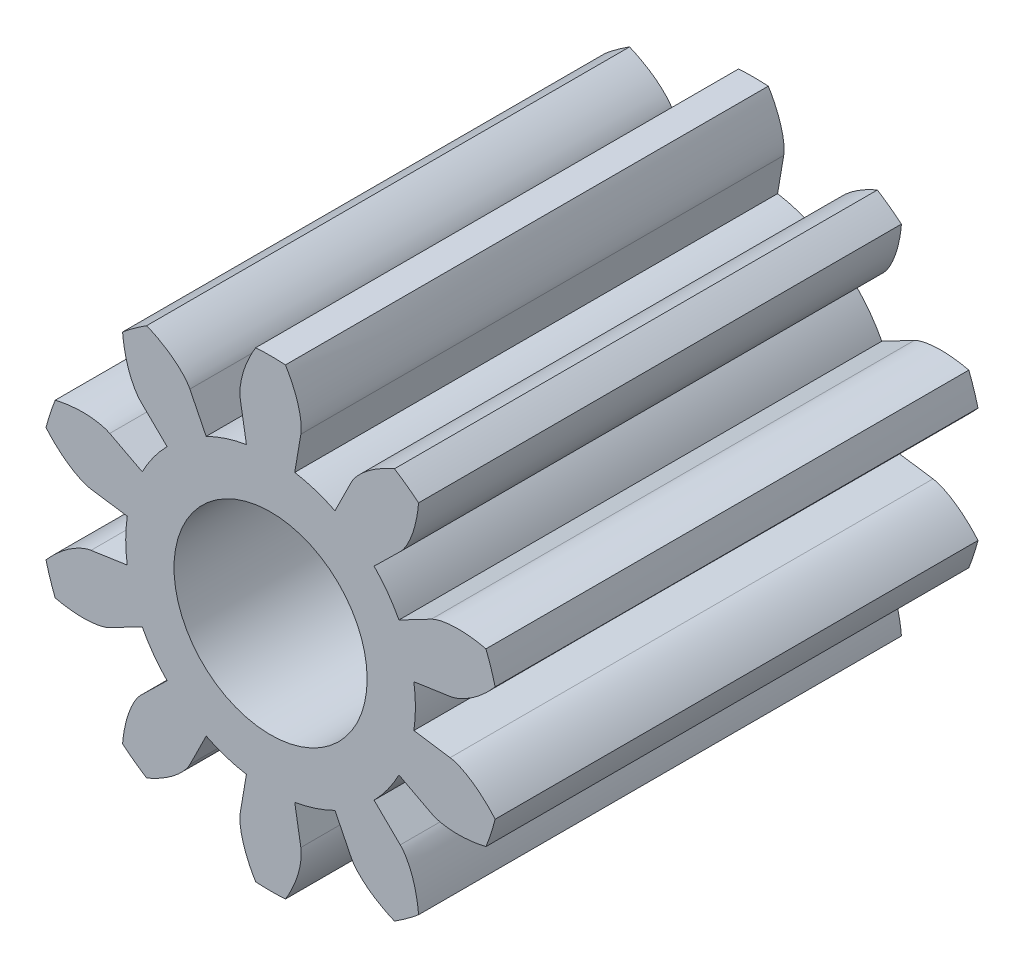
from build123d import *

# Parameters (mm, degrees)
SKETCH_1_R               = 1.2
SKETCH_1_R_2             = 0.5
EXTRUDE_1_DEPTH          = 2.5
CUT_EXTRUDE_1_DEPTH      = 4.021588986
PATTERN_CIRCULAR_1_COUNT = 10
PATTERN_CIRCULAR_1_ANGLE = 324


with BuildPart() as part:
    # 草图1 → 凸台-拉伸1 (new body)
    with BuildSketch(Plane.XY):
        Circle(SKETCH_1_R)
        Circle(SKETCH_1_R_2, mode=Mode.SUBTRACT)
    extrude(amount=EXTRUDE_1_DEPTH)

    # 草图1<3> → 切除-拉伸1 (cut, through all)
    with BuildSketch(Plane.XY):
        with BuildLine():
            Line((0.929617699, 0.137233941), (0.741958869, 0.109530982))
            ThreePointArc((0.741958869, 0.109530982), (0.747987016, 0.054912876), (0.75, 0))
            ThreePointArc((0.75, 0), (0.747987016, -0.054912876), (0.741958869, -0.109530982))
            Line((0.741958869, -0.109530982), (0.929617699, -0.137233941))
            add(Edge.make_bspline(
                [(0.929617699, -0.137233941), (0.936703923, -0.138280038), (0.956261919, -0.142672133), (0.992001136, -0.156827438), (1.046223416, -0.187497512), (1.09713679, -0.227889972), (1.134025911, -0.264346189), (1.15640568, -0.28944025), (1.162722009, -0.296778587)],
                knots=[0, 0, 0, 0, 0, 0.005604068, 0.015718248, 0.029959916, 0.048733667, 0.056327516, 0.056327516, 0.056327516, 0.056327516, 0.056327516], degree=4))
            ThreePointArc((1.162722009, -0.296778587), (1.19064403, -0.149555323), (1.2, 0))
            ThreePointArc((1.2, 0), (1.19064403, 0.149555323), (1.162722009, 0.296778587))
            add(Edge.make_bspline(
                [(0.929617699, 0.137233941), (0.936703923, 0.138280038), (0.956261919, 0.142672133), (0.992001136, 0.156827438), (1.046223416, 0.187497512), (1.09713679, 0.227889972), (1.134025911, 0.264346189), (1.15640568, 0.28944025), (1.162722009, 0.296778587)],
                knots=[0, 0, 0, 0, 0, 0.005604068, 0.015718248, 0.029959916, 0.048733667, 0.056327516, 0.056327516, 0.056327516, 0.056327516, 0.056327516], degree=4))
        make_face()
    cut_extrude_1 = extrude(amount=CUT_EXTRUDE_1_DEPTH, mode=Mode.SUBTRACT)

    # 阵列(圆周)1: 切除-拉伸1 ×10 about axis
    pattern_circular_1_axis = Axis((0, 0, 2.5), (0, 0, 1))
    for i in range(1, PATTERN_CIRCULAR_1_COUNT):
        add(cut_extrude_1.rotate(pattern_circular_1_axis, i * PATTERN_CIRCULAR_1_ANGLE / (PATTERN_CIRCULAR_1_COUNT - 1)), mode=Mode.SUBTRACT)


solid = part.part
